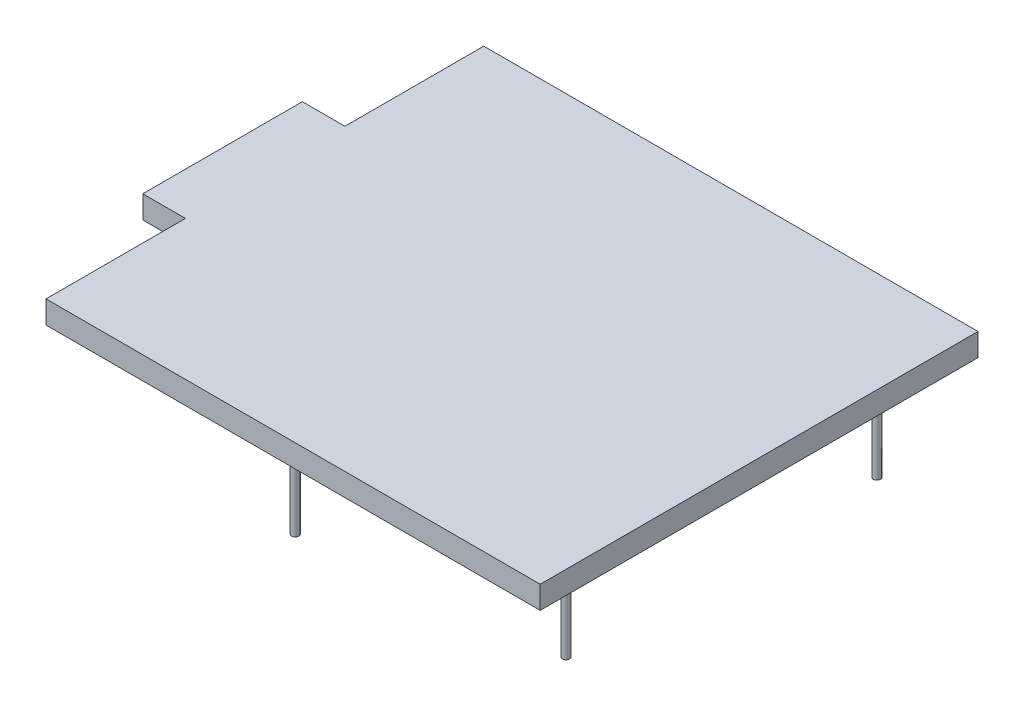
from build123d import *

# Parameters (mm, degrees)
BOSS_EXTRUDE1_DEPTH = 10
SKETCH2_R           = 1.6
BOSS_EXTRUDE2_DEPTH = 40


with BuildPart() as part:
    # Sketch1 → Boss-Extrude1 (new body)
    with BuildSketch(Plane(origin=(0, 0, 0), x_dir=(1, 0, 0), z_dir=(0, 1, 0))):
        Polygon((196.990512748, 28.023652023), (414.922512748, 28.023652023), (414.922512748, -165.016347977), (196.990512748, -165.016347977), (196.990512748, -103.548347977), (178.194512748, -103.548347977), (178.194512748, -33.190347977), (196.990512748, -33.190347977), align=None)
    extrude(amount=BOSS_EXTRUDE1_DEPTH)

    # Sketch2 → Boss-Extrude2 (add)
    with BuildSketch(Plane.XZ):
        with Locations((291.700512748, 149.842465897)):
            Circle(SKETCH2_R)
        with Locations((398.380512748, 137.085232309)):
            Circle(SKETCH2_R)
        with Locations((398.306929068, -0.074747953)):
            Circle(SKETCH2_R)
        with Locations((291.61330246, -12.71751071)):
            Circle(SKETCH2_R)
    extrude(amount=BOSS_EXTRUDE2_DEPTH)


solid = part.part
